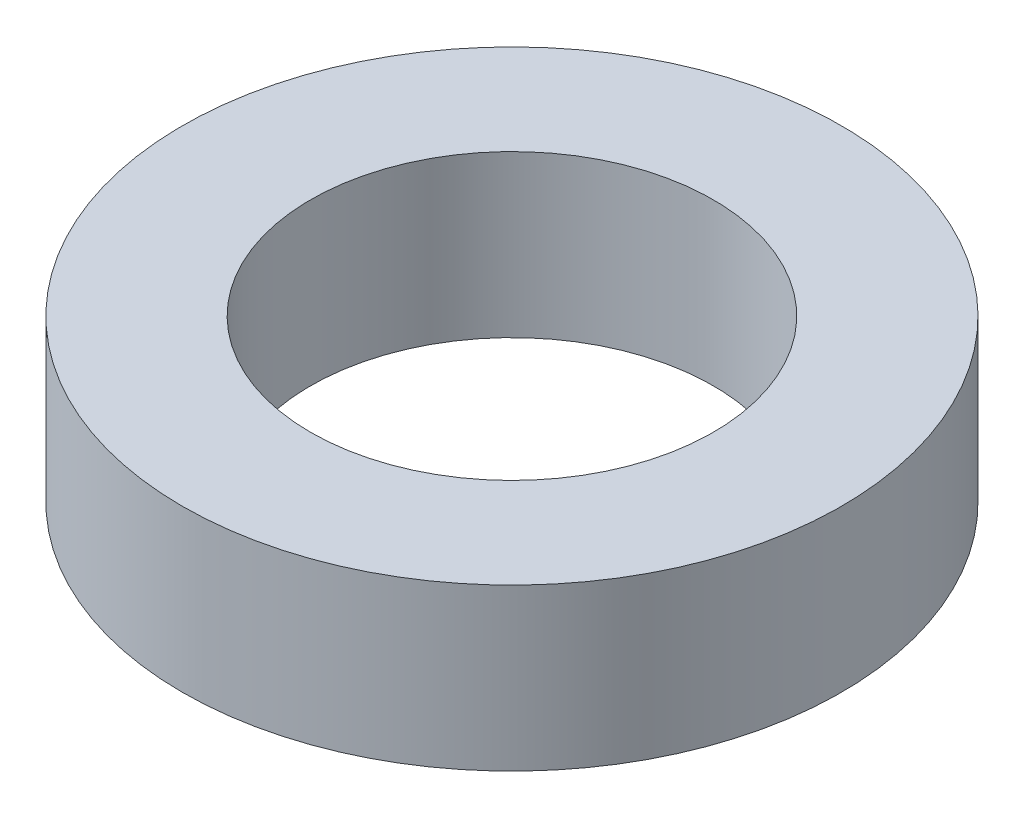
from build123d import *

# Parameters (mm, degrees)
SKETCH1_R           = 45
BOSS_EXTRUDE1_DEPTH = 22
SKETCH2_R           = 27.5
CUT_EXTRUDE1_DEPTH  = 68.334983478


with BuildPart() as part:
    # Sketch1 → Boss-Extrude1 (new body)
    with BuildSketch(Plane(origin=(0, 0, 0), x_dir=(1, 0, 0), z_dir=(0, 1, 0))):
        Circle(SKETCH1_R)
    extrude(amount=BOSS_EXTRUDE1_DEPTH)

    # Sketch2 → Cut-Extrude1 (cut, through all)
    with BuildSketch(Plane(origin=(0, 0, 0), x_dir=(1, 0, 0), z_dir=(0, 1, 0))):
        Circle(SKETCH2_R)
    extrude(amount=CUT_EXTRUDE1_DEPTH, mode=Mode.SUBTRACT)


solid = part.part
